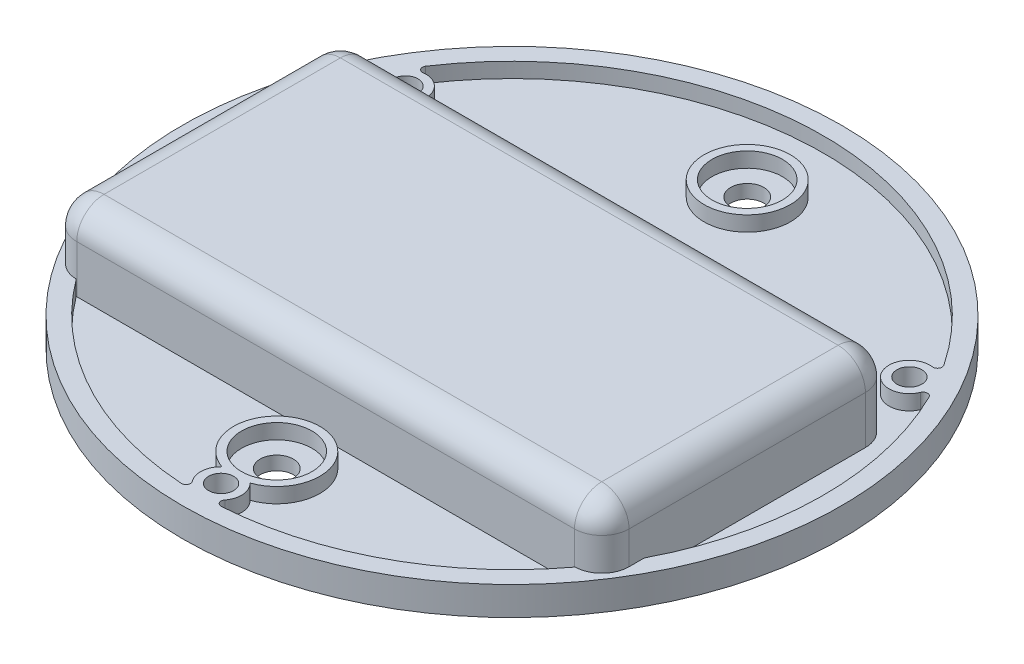
from build123d import *

# Parameters (mm, degrees)
ESQUISSE2_W                                 = 121.5
ESQUISSE2_H                                 = 64
BOSS_EXTRU_1_DEPTH                          = 16.5
CONG_1_R                                    = 6
ESQUISSE3_R                                 = 4.5
BOSS_EXTRU_4_DEPTH                          = 3.3
BOSS_EXTRU_4_2_DEPTH                        = 3.3
ESQUISSE3_R_2                               = 9.5
ESQUISSE3_R_3                               = 7.75
BOSS_EXTRU_4_3_DEPTH                        = 3.3
BOSS_EXTRU_4_4_DEPTH                        = 3.3
BOSS_EXTRU_5_START                          = -3.3
BOSS_EXTRU_5_DEPTH                          = 3.3
ESQUISSE5_R                                 = 3.65
ENL_V_MAT_EXTRU_1_DEPTH                     = 10
FRAISAGE_POUR_VIS_T_TE_FRAIS_E_M51_AT_COUNT = 2
FRAISAGE_POUR_VIS_T_TE_FRAIS_E_M51_AT_PITCH = 110.851251684
FRAISAGE_POUR_VIS_T_TE_FRAIS_E_M51_2_COUNT  = 2
FRAISAGE_POUR_VIS_T_TE_FRAIS_E_M51_2_PITCH  = 110.851251684
ESQUISSE8_R                                 = 6
BOSS_EXTRU_6_DEPTH                          = 3.5
BOSS_EXTRU_6_DRAFT                          = 14
BOSS_EXTRU_6_PROFILE_2_DEPTH                = 3.5
BOSS_EXTRU_6_PROFILE_2_DRAFT                = 14
BOSS_EXTRU_6_PROFILE_3_DEPTH                = 3.5
BOSS_EXTRU_6_PROFILE_3_DRAFT                = 14


with BuildPart() as part:
    # Esquisse1 → Révolution1 (revolve)
    with BuildSketch(Plane.XY, mode=Mode.PRIVATE) as r_volution1_sk:
        Polygon((0, 0), (-72.5, 0), (-72.5, 6.3), (-68.5, 6.3), (-68.5, 3), (0, 3), align=None)
    revolve(r_volution1_sk.sketch.rotate(Axis((0, 0, 0), (0, 1, 0)), 270), axis=Axis((0, 0, 0), (0, 1, 0)))

    # Esquisse2 → Boss.-Extru.1 (add)
    with BuildSketch(Plane(origin=(0, 3, 0), x_dir=(1, 0, 0), z_dir=(0, 1, 0))):
        with Locations((0, -9)):
            Rectangle(ESQUISSE2_W, ESQUISSE2_H)
    extrude(amount=BOSS_EXTRU_1_DEPTH)

    # Congé1
    # the kernel refuses this fillet: 6 mm, written as the material it takes off along each edge
    with BuildSketch(Plane(origin=(54.75, 13.5, -17), x_dir=(0, 1, 0), z_dir=(1, 0, 0))) as cong_1_piece_1_section:
        Polygon((0, 0), (CONG_1_R * 1.02, 0), (CONG_1_R * 1.02, -CONG_1_R * 1.02), (0, -CONG_1_R * 1.02), align=None)
    cong_1_piece_1 = extrude(amount=CONG_1_R * 1.02, mode=Mode.PRIVATE)
    cong_1_piece_1 = cong_1_piece_1 - Plane(origin=(54.75, 13.5, -17), x_dir=(0, -0.7071067811865475, 0.7071067811865475), z_dir=(1, 0, 0)) * Sphere(CONG_1_R, mode=Mode.PRIVATE)
    add(cong_1_piece_1, mode=Mode.SUBTRACT)
    with BuildSketch(Plane(origin=(-54.75, 13.5, -17), x_dir=(0, 0, -1), z_dir=(0, 1, 0))) as cong_1_piece_2_section:
        Polygon((0, 0), (CONG_1_R * 1.02, 0), (CONG_1_R * 1.02, CONG_1_R * 1.02), (0, CONG_1_R * 1.02), align=None)
    cong_1_piece_2 = extrude(amount=CONG_1_R * 1.02, mode=Mode.PRIVATE)
    cong_1_piece_2 = cong_1_piece_2 - Plane(origin=(-54.75, 13.5, -17), x_dir=(0.7071067811865475, 0, 0.7071067811865475), z_dir=(0, 1, 0)) * Sphere(CONG_1_R, mode=Mode.PRIVATE)
    add(cong_1_piece_2, mode=Mode.SUBTRACT)
    with BuildSketch(Plane(origin=(54.75, 13.5, 35), x_dir=(1, 0, 0), z_dir=(0, 0, 1))) as cong_1_piece_3_section:
        Polygon((0, 0), (CONG_1_R * 1.02, 0), (CONG_1_R * 1.02, CONG_1_R * 1.02), (0, CONG_1_R * 1.02), align=None)
    cong_1_piece_3 = extrude(amount=CONG_1_R * 1.02, mode=Mode.PRIVATE)
    cong_1_piece_3 = cong_1_piece_3 - Plane(origin=(54.75, 13.5, 35), x_dir=(-0.7071067811865475, -0.7071067811865475, 0), z_dir=(0, 0, 1)) * Sphere(CONG_1_R, mode=Mode.PRIVATE)
    add(cong_1_piece_3, mode=Mode.SUBTRACT)
    with BuildSketch(Plane(origin=(-54.75, 13.5, 35), x_dir=(0, 1, 0), z_dir=(0, 0, 1))) as cong_1_piece_4_section:
        Polygon((0, 0), (CONG_1_R * 1.02, 0), (CONG_1_R * 1.02, CONG_1_R * 1.02), (0, CONG_1_R * 1.02), align=None)
    cong_1_piece_4 = extrude(amount=CONG_1_R * 1.02, mode=Mode.PRIVATE)
    cong_1_piece_4 = cong_1_piece_4 - Plane(origin=(-54.75, 13.5, 35), x_dir=(0.7071067811865475, -0.7071067811865475, 0), z_dir=(0, 0, 1)) * Sphere(CONG_1_R, mode=Mode.PRIVATE)
    add(cong_1_piece_4, mode=Mode.SUBTRACT)
    with BuildSketch(Plane(origin=(54.75, 19.5, -23), x_dir=(0, 0, 1), z_dir=(-1, 0, 0)), Plane(origin=(-54.75, 19.5, 41), x_dir=(0, 0, -1), z_dir=(1, 0, 0))) as cong_1_piece_5:
        with BuildLine():
            CenterArc((CONG_1_R, -CONG_1_R), CONG_1_R, 90, 90)
            Line((0, -CONG_1_R), (0, 0))
            Line((0, 0), (CONG_1_R, 0))
        make_face()
    extrude(amount=109.5, mode=Mode.SUBTRACT)
    with BuildSketch(Plane(origin=(60.75, 19.5, 35), x_dir=(0, -1, 0), z_dir=(0, 0, -1))) as cong_1_piece_6:
        with BuildLine():
            CenterArc((CONG_1_R, CONG_1_R), CONG_1_R, 180, 90)
            Line((0, CONG_1_R), (0, 0))
            Line((0, 0), (CONG_1_R, 0))
        make_face()
    extrude(amount=52, mode=Mode.SUBTRACT)
    with BuildSketch(Plane(origin=(-60.75, 19.5, -17), x_dir=(1, 0, 0), z_dir=(0, 0, 1))) as cong_1_piece_7:
        with BuildLine():
            CenterArc((CONG_1_R, -CONG_1_R), CONG_1_R, 90, 90)
            Line((0, -CONG_1_R), (0, 0))
            Line((0, 0), (CONG_1_R, 0))
        make_face()
    extrude(amount=52, mode=Mode.SUBTRACT)
    with BuildSketch(Plane(origin=(60.75, 3, 41), x_dir=(0, 0, -1), z_dir=(0, 1, 0))) as cong_1_piece_8_section:
        with BuildLine():
            CenterArc((CONG_1_R, CONG_1_R), CONG_1_R, 180, 90)
            Line((0, CONG_1_R), (0, 0))
            Line((0, 0), (CONG_1_R, 0))
        make_face()
    cong_1_piece_8 = extrude(amount=10.5, mode=Mode.PRIVATE)
    cong_1_piece_8 = cong_1_piece_8 & Plane(origin=(0, 4.65, 0), x_dir=(0, 0, -1), z_dir=(0, -1, 0)) * Cylinder(68.5, 45, mode=Mode.PRIVATE)
    add(cong_1_piece_8, mode=Mode.SUBTRACT)
    with BuildSketch(Plane(origin=(60.75, -12, 41), x_dir=(0, 0, -1), z_dir=(0, 1, 0))) as cong_1_piece_9_section:
        with BuildLine():
            CenterArc((CONG_1_R, CONG_1_R), CONG_1_R, 180, 90)
            Line((0, CONG_1_R), (0, 0))
            Line((0, 0), (CONG_1_R, 0))
        make_face()
    cong_1_piece_9 = extrude(amount=25.5, mode=Mode.PRIVATE)
    cong_1_piece_9 = split(cong_1_piece_9, bisect_by=Plane(origin=(59.311330045, 6.3, 39.576455151), z_dir=(0, 1, 0)), keep=Keep.TOP, mode=Mode.PRIVATE)
    add(cong_1_piece_9, mode=Mode.SUBTRACT)
    with BuildSketch(Plane(origin=(60.75, -12, 41), x_dir=(0, 0, -1), z_dir=(0, 1, 0))) as cong_1_piece_10_section:
        with BuildLine():
            CenterArc((CONG_1_R, CONG_1_R), CONG_1_R, 180, 90)
            Line((0, CONG_1_R), (0, 0))
            Line((0, 0), (CONG_1_R, 0))
        make_face()
    cong_1_piece_10 = extrude(amount=25.5, mode=Mode.PRIVATE)
    cong_1_piece_10 = cong_1_piece_10 - Plane(origin=(0, 4.65, 0), x_dir=(0, 0, -1), z_dir=(0, 1, 0)) * Cylinder(72.5, 75, mode=Mode.PRIVATE)
    add(cong_1_piece_10, mode=Mode.SUBTRACT)
    with BuildSketch(Plane(origin=(60.75, 3, -23), x_dir=(0, 0, 1), z_dir=(0, 1, 0)), Plane(origin=(-60.75, 3, -23), x_dir=(1, 0, 0), z_dir=(0, 1, 0))) as cong_1_piece_11:
        with BuildLine():
            CenterArc((CONG_1_R, -CONG_1_R), CONG_1_R, 90, 90)
            Line((0, -CONG_1_R), (0, 0))
            Line((0, 0), (CONG_1_R, 0))
        make_face()
    extrude(amount=10.5, mode=Mode.SUBTRACT)
    with BuildSketch(Plane(origin=(-60.75, 3, 41), x_dir=(1, 0, 0), z_dir=(0, 1, 0))) as cong_1_piece_12_section:
        with BuildLine():
            CenterArc((CONG_1_R, CONG_1_R), CONG_1_R, 180, 90)
            Line((0, CONG_1_R), (0, 0))
            Line((0, 0), (CONG_1_R, 0))
        make_face()
    cong_1_piece_12 = extrude(amount=10.5, mode=Mode.PRIVATE)
    cong_1_piece_12 = cong_1_piece_12 & Plane(origin=(0, 4.65, 0), x_dir=(0, 0, -1), z_dir=(0, -1, 0)) * Cylinder(68.5, 45, mode=Mode.PRIVATE)
    add(cong_1_piece_12, mode=Mode.SUBTRACT)
    with BuildSketch(Plane(origin=(-60.75, -12, 41), x_dir=(1, 0, 0), z_dir=(0, 1, 0))) as cong_1_piece_13_section:
        with BuildLine():
            CenterArc((CONG_1_R, CONG_1_R), CONG_1_R, 180, 90)
            Line((0, CONG_1_R), (0, 0))
            Line((0, 0), (CONG_1_R, 0))
        make_face()
    cong_1_piece_13 = extrude(amount=25.5, mode=Mode.PRIVATE)
    cong_1_piece_13 = split(cong_1_piece_13, bisect_by=Plane(origin=(-59.311330045, 6.3, 39.576455151), z_dir=(0, 1, 0)), keep=Keep.TOP, mode=Mode.PRIVATE)
    add(cong_1_piece_13, mode=Mode.SUBTRACT)
    with BuildSketch(Plane(origin=(-60.75, -12, 41), x_dir=(1, 0, 0), z_dir=(0, 1, 0))) as cong_1_piece_14_section:
        with BuildLine():
            CenterArc((CONG_1_R, CONG_1_R), CONG_1_R, 180, 90)
            Line((0, CONG_1_R), (0, 0))
            Line((0, 0), (CONG_1_R, 0))
        make_face()
    cong_1_piece_14 = extrude(amount=25.5, mode=Mode.PRIVATE)
    cong_1_piece_14 = cong_1_piece_14 - Plane(origin=(0, 4.65, 0), x_dir=(0, 0, -1), z_dir=(0, 1, 0)) * Cylinder(72.5, 75, mode=Mode.PRIVATE)
    add(cong_1_piece_14, mode=Mode.SUBTRACT)



with BuildPart() as body_2:
    # Esquisse3 → Boss.-Extru.4 (new body)
    with BuildSketch(Plane(origin=(0, 6.3, 0), x_dir=(1, 0, 0), z_dir=(0, 1, 0))):
        with Locations(Location((-55.425625842, 32, 0), (0, 0, 270))):
            Circle(ESQUISSE3_R)
    extrude(amount=-BOSS_EXTRU_4_DEPTH)


with BuildPart() as body_3:
    # Esquisse3 → Boss.-Extru.4 2 (new body)
    with BuildSketch(Plane(origin=(0, 6.3, 0), x_dir=(1, 0, 0), z_dir=(0, 1, 0))):
        with Locations(Location((55.425625842, 32, 0), (0, 0, 270))):
            Circle(ESQUISSE3_R)
    extrude(amount=-BOSS_EXTRU_4_2_DEPTH)


with BuildPart() as body_4:
    # Esquisse3 → Boss.-Extru.4 3 (new body)
    with BuildSketch(Plane(origin=(0, 6.3, 0), x_dir=(1, 0, 0), z_dir=(0, 1, 0))):
        with Locations(Location((0, 51.75, 0), (0, 0, 90))):
            Circle(ESQUISSE3_R_2)
        with Locations(Location((0, 51.75, 0), (0, 0, 90))):
            Circle(ESQUISSE3_R_3, mode=Mode.SUBTRACT)
    extrude(amount=-BOSS_EXTRU_4_3_DEPTH)


with BuildPart() as body_5:
    # Esquisse3 → Boss.-Extru.4 4 (new body)
    with BuildSketch(Plane(origin=(0, 6.3, 0), x_dir=(1, 0, 0), z_dir=(0, 1, 0))):
        with BuildLine():
            ThreePointArc((-3.093721011, -60.732142857), (0, -68.5), (3.093721011, -60.732142857))
            ThreePointArc((3.093721011, -60.732142857), (0, -42.25), (-3.093721011, -60.732142857))
        make_face()
        with Locations(Location((0, -51.75, 0), (0, 0, 270))):
            Circle(ESQUISSE3_R_3, mode=Mode.SUBTRACT)
    extrude(amount=-BOSS_EXTRU_4_4_DEPTH)


with BuildPart() as part_1:
    add(part.part)

    add(body_2.part)  # Boss.-Extru.5 merges body 2

    add(body_3.part)  # Boss.-Extru.5 merges body 3

    add(body_5.part)  # Boss.-Extru.5 merges body 5
    # Esquisse4 → Boss.-Extru.5 (add)
    with BuildSketch(Plane(origin=(0, 6.3, 0), x_dir=(1, 0, 0), z_dir=(0, 1, 0)).offset(BOSS_EXTRU_5_START)):
        with BuildLine():
            ThreePointArc((-59.322739983, 34.250000305), (-57.930490853, 35.738402236), (-56.024441593, 36.459979787))
            ThreePointArc((-56.024441593, 36.459979787), (-57.005800364, 36.92155223), (-56.989474897, 38.005917316))
            ThreePointArc((-56.989474897, 38.005917316), (-58.186420759, 36.146790166), (-59.322739983, 34.250000305))
        make_face()
        with BuildLine():
            ThreePointArc((-59.587489513, 30.288599759), (-59.91560963, 32.300075966), (-59.322739983, 34.250000305))
            ThreePointArc((-59.322739983, 34.250000305), (-60.397248762, 32.31752376), (-61.408827338, 30.351374351))
            ThreePointArc((-61.408827338, 30.351374351), (-60.477902361, 30.907695163), (-59.587489513, 30.288599759))
        make_face()
        with BuildLine():
            ThreePointArc((56.024441593, 36.459979787), (57.930491108, 35.738402065), (59.32274029, 34.249999774))
            ThreePointArc((59.32274029, 34.249999774), (58.18642092, 36.146789906), (56.989474897, 38.005917316))
            ThreePointArc((56.989474897, 38.005917316), (57.005800364, 36.92155223), (56.024441593, 36.459979787))
        make_face()
        with BuildLine():
            ThreePointArc((59.32274029, 34.249999774), (59.91560965, 32.300075661), (59.587489513, 30.288599759))
            ThreePointArc((59.587489513, 30.288599759), (60.477902361, 30.907695163), (61.408827338, 30.351374351))
            ThreePointArc((61.408827338, 30.351374351), (60.397248907, 32.31752349), (59.32274029, 34.249999774))
        make_face()
        with BuildLine():
            ThreePointArc((-3.56304792, -66.748579545), (-3.472101996, -67.829247394), (-4.419352441, -68.357291667))
            ThreePointArc((-4.419352441, -68.357291667), (-2.210827995, -68.464313621), (-2e-09, -68.5))
            ThreePointArc((-2e-09, -68.5), (-1.985118643, -68.038477928), (-3.56304792, -66.748579545))
        make_face()
        with BuildLine():
            ThreePointArc((3.56304792, -66.748579545), (1.985118641, -68.038477929), (-2e-09, -68.5))
            ThreePointArc((-2e-09, -68.5), (2.210827992, -68.464313621), (4.419352441, -68.357291667))
            ThreePointArc((4.419352441, -68.357291667), (3.472101996, -67.829247394), (3.56304792, -66.748579545))
        make_face()
    extrude(amount=BOSS_EXTRU_5_DEPTH)

    # Esquisse5 → Enlèv. mat.-Extru.1 (cut)
    with BuildSketch(Plane(origin=(0, 3, 0), x_dir=(1, 0, 0), z_dir=(0, 1, 0))):
        with Locations(Location((0, -51.75, 0), (0, 0, 270))):
            Circle(ESQUISSE5_R)
        with Locations(Location((0, 51.75, 0), (0, 0, 270))):
            Circle(ESQUISSE5_R)
    extrude(amount=-ENL_V_MAT_EXTRU_1_DEPTH, mode=Mode.SUBTRACT)

    # Esquisse6 → Fraisage pour vis à tête fraisée M51 (revolve, cut)
    with BuildSketch(Plane(origin=(0, 0, 64), x_dir=(0, 0, -1), z_dir=(1, 0, 0))):
        Polygon((0, 0), (0, 19.5), (2.75, 19.5), (2.75, 2.45), (5.2, 0), align=None)
    fraisage_pour_vis_t_te_frais_e_m51 = revolve(axis=Axis((0, -6.35, 64), (0, 1, 0)), mode=Mode.SUBTRACT)

    # Fraisage pour vis à tête fraisée M51 at: Fraisage pour vis à tête fraisée M51 ×2
    with Locations(*[Vector(0.5000000000000041, 0, -0.8660254037844364) * (i * FRAISAGE_POUR_VIS_T_TE_FRAIS_E_M51_AT_PITCH) for i in range(1, FRAISAGE_POUR_VIS_T_TE_FRAIS_E_M51_AT_COUNT)]):
        add(fraisage_pour_vis_t_te_frais_e_m51, mode=Mode.SUBTRACT)

    # Fraisage pour vis _ t_te frais_e M51 2: Fraisage pour vis à tête fraisée M51 ×2
    with Locations(*[Vector(-0.49999999999999806, 0, -0.8660254037844398) * (i * FRAISAGE_POUR_VIS_T_TE_FRAIS_E_M51_2_PITCH) for i in range(1, FRAISAGE_POUR_VIS_T_TE_FRAIS_E_M51_2_COUNT)]):
        add(fraisage_pour_vis_t_te_frais_e_m51, mode=Mode.SUBTRACT)


with BuildPart() as boss_extru_6_tool:
    # Esquisse8 → Boss.-Extru.6 (with draft: the straight prism first)
    with BuildSketch(Plane.XZ):
        with Locations((-46, -42.5)):
            Circle(ESQUISSE8_R)
    extrude(amount=BOSS_EXTRU_6_DEPTH)
    # Boss.-Extru.6: the draft: its side faces are tilted about the plane it starts from
    boss_extru_6_sides = [boss_extru_6_tool.faces().sort_by_distance(p)[0] for p in [
        (-52, -1.75, -42.5),
    ]]
    draft(boss_extru_6_sides, Plane.XZ, BOSS_EXTRU_6_DRAFT)


with BuildPart() as part_2:
    add(part_1.part)

    # Boss.-Extru.6: add boss_extru_6_tool
    add(boss_extru_6_tool.part)


with BuildPart() as boss_extru_6_profile_2_tool:
    # Esquisse8 → Boss.-Extru.6 profile 2 (with draft: the straight prism first)
    with BuildSketch(Plane.XZ):
        with Locations((46, -42.5)):
            Circle(ESQUISSE8_R)
    extrude(amount=BOSS_EXTRU_6_PROFILE_2_DEPTH)
    # Boss.-Extru.6 profile 2: the draft: its side faces are tilted about the plane it starts from
    boss_extru_6_profile_2_sides = [boss_extru_6_profile_2_tool.faces().sort_by_distance(p)[0] for p in [
        (40, -1.75, -42.5),
    ]]
    draft(boss_extru_6_profile_2_sides, Plane.XZ, BOSS_EXTRU_6_PROFILE_2_DRAFT)


with BuildPart() as part_3:
    add(part_2.part)

    # Boss.-Extru.6 profile 2: add boss_extru_6_profile_2_tool
    add(boss_extru_6_profile_2_tool.part)


with BuildPart() as boss_extru_6_profile_3_tool:
    # Esquisse8 → Boss.-Extru.6 profile 3 (with draft: the straight prism first)
    with BuildSketch(Plane.XZ):
        with Locations((10.953821361, 61.664663281)):
            Circle(ESQUISSE8_R)
    extrude(amount=BOSS_EXTRU_6_PROFILE_3_DEPTH)
    # Boss.-Extru.6 profile 3: the draft: its side faces are tilted about the plane it starts from
    boss_extru_6_profile_3_sides = [boss_extru_6_profile_3_tool.faces().sort_by_distance(p)[0] for p in [
        (4.953821361, -1.75, 61.664663281),
    ]]
    draft(boss_extru_6_profile_3_sides, Plane.XZ, BOSS_EXTRU_6_PROFILE_3_DRAFT)


with BuildPart() as part_4:
    add(part_3.part)

    # Boss.-Extru.6 profile 3: add boss_extru_6_profile_3_tool
    add(boss_extru_6_profile_3_tool.part)


solid = Compound([body_4.part, part_4.part])
